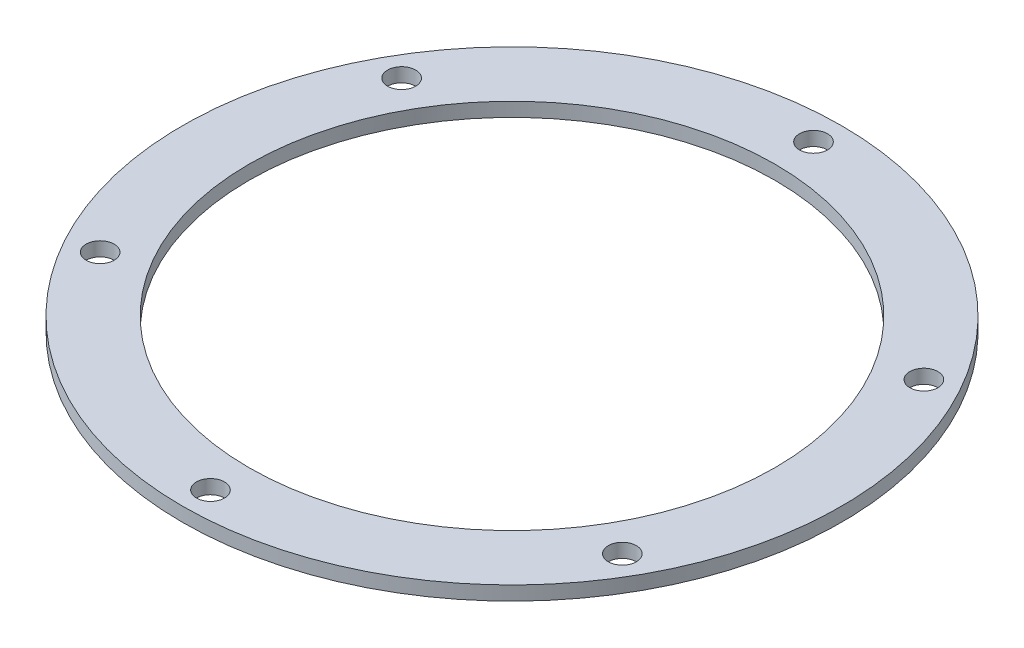
from build123d import *

# Parameters (mm, degrees)
SKETCH1_R           = 47
SKETCH1_R_2         = 37.5
SKETCH1_R_3         = 2
BOSS_EXTRUDE1_DEPTH = 2


with BuildPart() as part:
    # Sketch1 → Boss-Extrude1 (new body)
    with BuildSketch(Plane(origin=(0, 0, 0), x_dir=(1, 0, 0), z_dir=(0, 1, 0))):
        Circle(SKETCH1_R)
        Circle(SKETCH1_R_2, mode=Mode.SUBTRACT)
        with Locations((0, 43)):
            Circle(SKETCH1_R_3, mode=Mode.SUBTRACT)
        with Locations((37.239092363, 21.5)):
            Circle(SKETCH1_R_3, mode=Mode.SUBTRACT)
        with Locations((37.239092363, -21.5)):
            Circle(SKETCH1_R_3, mode=Mode.SUBTRACT)
        with Locations((0, -43)):
            Circle(SKETCH1_R_3, mode=Mode.SUBTRACT)
        with Locations((-37.239092363, -21.5)):
            Circle(SKETCH1_R_3, mode=Mode.SUBTRACT)
        with Locations((-37.239092363, 21.5)):
            Circle(SKETCH1_R_3, mode=Mode.SUBTRACT)
    extrude(amount=BOSS_EXTRUDE1_DEPTH)


solid = part.part
